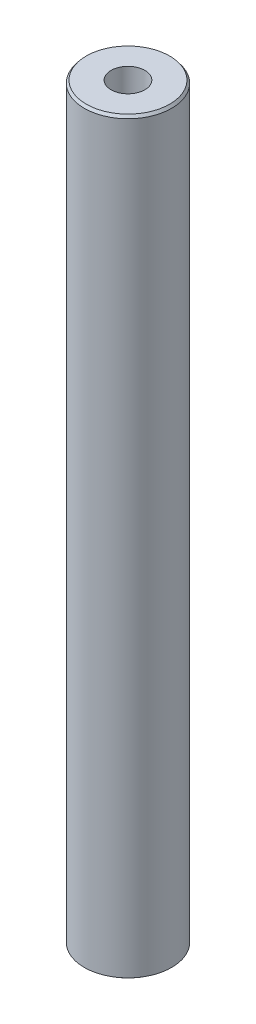
from build123d import *
from OCP.BRepFilletAPI import BRepFilletAPI_MakeChamfer

# Parameters (mm, degrees)
SKETCH1_R           = 35
BOSS_EXTRUDE1_DEPTH = 600
SKETCH2_R           = 13.530390819
CUT_EXTRUDE1_DEPTH  = 603.038204768
CHAMFER1_SIZE       = 2.115902147
CHAMFER1_SIZE2      = 1.550765432


with BuildPart() as part:
    # Sketch1 → Boss-Extrude1 (new body)
    with BuildSketch(Plane(origin=(0, 0, 0), x_dir=(1, 0, 0), z_dir=(0, 1, 0))):
        Circle(SKETCH1_R)
    extrude(amount=BOSS_EXTRUDE1_DEPTH)

    # Sketch2 → Cut-Extrude1 (cut, through all)
    with BuildSketch(Plane(origin=(0, 0, 0), x_dir=(1, 0, 0), z_dir=(0, 1, 0))):
        Circle(SKETCH2_R)
    extrude(amount=CUT_EXTRUDE1_DEPTH, mode=Mode.SUBTRACT)

    # Chamfer1: one chamfer whose edges measure the first distance from different faces: ONE call of the kernel's chamfer builder (chamfer() names one face for all edges)
    chamfer1_edges_1 = [part.edges().sort_by_distance(p)[0] for p in [
        (-35, 600, 0),
    ]]
    chamfer1_side_1 = [part.faces().sort_by_distance(p)[0] for p in [
        (-35, 300, 0),
    ]]
    chamfer1_edges_2 = [part.edges().sort_by_distance(p)[0] for p in [
        (-35, 0, 0),
    ]]
    chamfer1_side_2 = [part.faces().sort_by_distance(p)[0] for p in [
        (-34.010050506, 0, 0),
    ]]
    chamfer1 = BRepFilletAPI_MakeChamfer(part.part.solid().wrapped)
    for e in chamfer1_edges_1:
        chamfer1.Add(CHAMFER1_SIZE, CHAMFER1_SIZE2, e.wrapped, chamfer1_side_1[0].wrapped)  # the first distance lies on this face
    for e in chamfer1_edges_2:
        chamfer1.Add(CHAMFER1_SIZE, CHAMFER1_SIZE2, e.wrapped, chamfer1_side_2[0].wrapped)  # the first distance lies on this face
    add(Compound.cast(chamfer1.Shape()), mode=Mode.REPLACE)


solid = part.part
